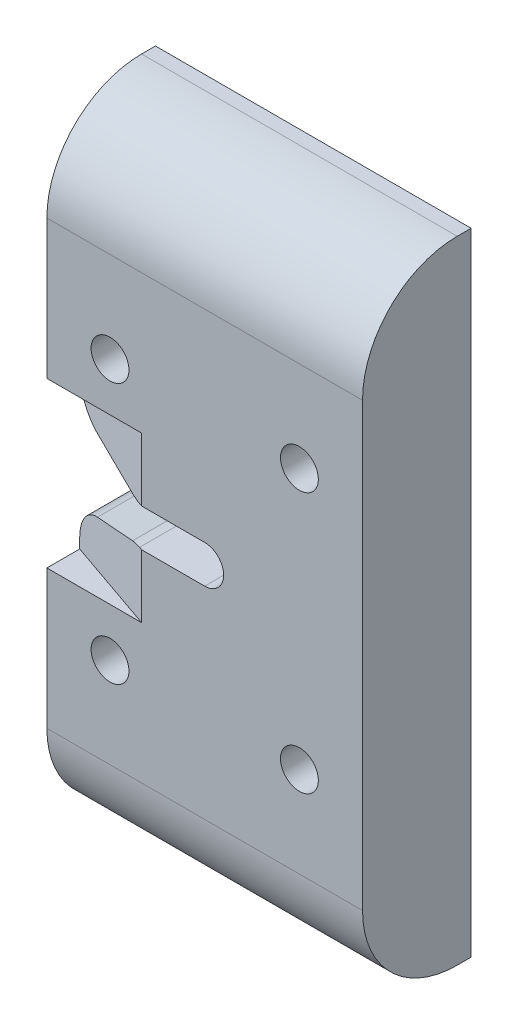
from build123d import *

# Parameters (mm, degrees)
SKETCH_1_W          = 50
SKETCH_1_H          = 100
EXTRUDE_1_DEPTH     = 17.2
FILLET_1_R          = 15
CUT_EXTRUDE_3_DEPTH = 26
SKETCH_6_R          = 3
CUT_EXTRUDE_4_DEPTH = 114.11869872
CUT_EXTRUDE_5_DEPTH = 114.11869872
FILLET_2_R          = 6
FILLET_3_R          = 6
SKETCH_9_R          = 3
CUT_EXTRUDE_6_DEPTH = 114.11869872
SKETCH_10_R         = 6
CUT_EXTRUDE_7_DEPTH = 9


with BuildPart() as part:
    # Эскиз1 → Бобышка-Вытянуть1 (new body)
    with BuildSketch(Plane.XY):
        with Locations((25, 50)):
            Rectangle(SKETCH_1_W, SKETCH_1_H)
    extrude(amount=EXTRUDE_1_DEPTH)

    # Скругление1
    fillet_1_edges = [part.edges().sort_by_distance(p)[0] for p in [
        (25, 0, 17.2),
        (25, 100, 17.2),
    ]]
    fillet(fillet_1_edges, radius=FILLET_1_R)

    # Эскиз5 → Вырез-Вытянуть3 (cut)
    with BuildSketch(Plane(origin=(0, 37, 0), x_dir=(1, 0, 0), z_dir=(0, 1, 0))):
        Polygon((0, -17.2), (0, -12), (15, -17.2), align=None)
    extrude(amount=CUT_EXTRUDE_3_DEPTH, mode=Mode.SUBTRACT)

    # Эскиз6 → Вырез-Вытянуть4 (cut, through all)
    with BuildSketch(Plane.XY.offset(17.2)):
        with Locations((25, 50)):
            Circle(SKETCH_6_R)
    extrude(amount=-CUT_EXTRUDE_4_DEPTH, mode=Mode.SUBTRACT)

    # Эскиз7 → Вырез-Вытянуть5 (cut, through all)
    with BuildSketch(Plane(origin=(0, 0, 0), x_dir=(-1, 0, 0), z_dir=(0, 0, -1))):
        Polygon((0, 57), (0, 43), (-13.646386899, 47), (-25, 47), (-25, 53), (-13.646386899, 53), align=None)
    extrude(amount=-CUT_EXTRUDE_5_DEPTH, mode=Mode.SUBTRACT)

    # Скругление2
    fillet_2_edges = [part.edges().sort_by_distance(p)[0] for p in [
        (0, 43, 6),
        (0, 57, 6),
    ]]
    fillet(fillet_2_edges, radius=FILLET_2_R)

    # Скругление3
    fillet_3_edges = [part.edges().sort_by_distance(p)[0] for p in [
        (13.646386899, 47, 8.365373729),
        (13.646386899, 53, 8.365373729),
    ]]
    fillet(fillet_3_edges, radius=FILLET_3_R)

    # Эскиз9 → Вырез-Вытянуть6 (cut, through all)
    with BuildSketch(Plane(origin=(0, 0, 0), x_dir=(-1, 0, 0), z_dir=(0, 0, -1))):
        with Locations((-40, 29.35)):
            Circle(SKETCH_9_R)
        with Locations((-10, 29.35)):
            Circle(SKETCH_9_R)
        with Locations((-10, 70.65)):
            Circle(SKETCH_9_R)
        with Locations((-40, 70.65)):
            Circle(SKETCH_9_R)
    extrude(amount=-CUT_EXTRUDE_6_DEPTH, mode=Mode.SUBTRACT)

    # Эскиз10 → Вырез-Вытянуть7 (cut)
    with BuildSketch(Plane(origin=(0, 0, 0), x_dir=(-1, 0, 0), z_dir=(0, 0, -1))):
        with Locations((-40, 29.35)):
            Circle(SKETCH_10_R)
        with Locations((-10, 29.35)):
            Circle(SKETCH_10_R)
        with Locations((-10, 70.65)):
            Circle(SKETCH_10_R)
        with Locations((-40, 70.65)):
            Circle(SKETCH_10_R)
    extrude(amount=-CUT_EXTRUDE_7_DEPTH, mode=Mode.SUBTRACT)


solid = part.part
